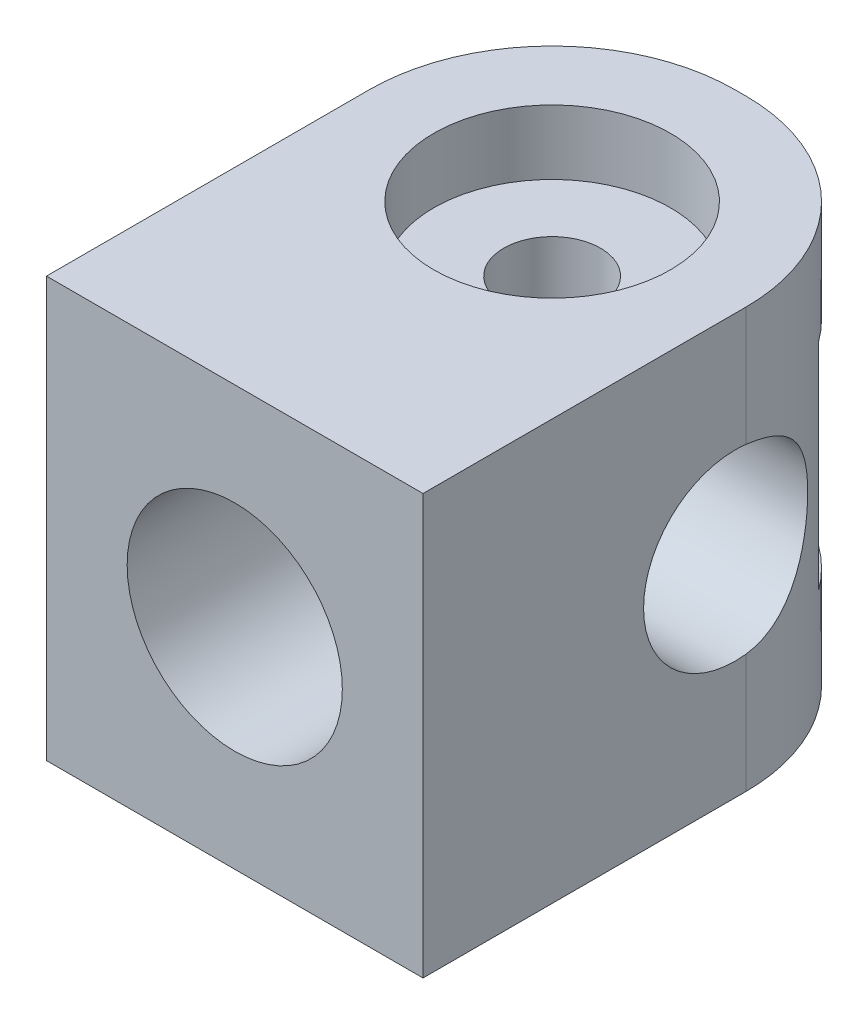
from build123d import *

# Parameters (mm, degrees)
ESQUISSE1_W             = 35
ESQUISSE1_H             = 39
BOSS_EXTRU_1_DEPTH      = 47
ESQUISSE2_R             = 10
ENL_V_MAT_EXTRU_1_DEPTH = 20
CONG_1_R                = 17
ESQUISSE3_W             = 35
ESQUISSE3_H             = 20
ENL_V_MAT_EXTRU_2_DEPTH = 7
ESQUISSE4_R             = 8.5
ENL_V_MAT_EXTRU_3_DEPTH = 29
ENL_V_MAT_EXTRU_4_DEPTH = 71.391760987
ESQUISSE7_R             = 11
ENL_V_MAT_EXTRU_5_DEPTH = 6
ENL_V_START             = -6
ESQUISSE8_R             = 11
ENL_V_MAT_EXTRU_6_DEPTH = 6
ESQUISSE10_R            = 4.5
ENL_V_MAT_EXTRU_7_DEPTH = 6


with BuildPart() as part:
    # Esquisse1 → Boss.-Extru.1 (new body)
    with BuildSketch(Plane.XY):
        with Locations((17.5, -19.5)):
            Rectangle(ESQUISSE1_W, ESQUISSE1_H)
    extrude(amount=BOSS_EXTRU_1_DEPTH)

    # Esquisse2 → Enlèv. mat.-Extru.1 (cut)
    with BuildSketch(Plane.XY.offset(47)):
        with Locations((17.5, -19.5)):
            Circle(ESQUISSE2_R)
    extrude(amount=-ENL_V_MAT_EXTRU_1_DEPTH, mode=Mode.SUBTRACT)

    # Congé1
    cong_1_edges = [part.edges().sort_by_distance(p)[0] for p in [
        (0, -19.5, 0),
        (35, -19.5, 0),
    ]]
    fillet(cong_1_edges, radius=CONG_1_R)

    # Esquisse3 → Enlèv. mat.-Extru.2 (cut)
    with BuildSketch(Plane(origin=(0, 0, 0), x_dir=(-1, 0, 0), z_dir=(0, 0, -1))):
        with Locations((-17.5, -19.5)):
            Rectangle(ESQUISSE3_W, ESQUISSE3_H)
    extrude(amount=-ENL_V_MAT_EXTRU_2_DEPTH, mode=Mode.SUBTRACT)

    # Esquisse4 → Enlèv. mat.-Extru.3 (cut)
    with BuildSketch(Plane(origin=(35, 0, 0), x_dir=(0, 0, -1), z_dir=(1, 0, 0))):
        with Locations((-18, -19.5)):
            Circle(ESQUISSE4_R)
    extrude(amount=-ENL_V_MAT_EXTRU_3_DEPTH, mode=Mode.SUBTRACT)

    # Esquisse5 → Enlèv. mat.-Extru.4 (cut, through all)
    with BuildSketch(Plane(origin=(0, 0, 0), x_dir=(1, 0, 0), z_dir=(0, 1, 0))):
        with BuildLine():
            ThreePointArc((22, -17.5), (14.318019485, -14.318019485), (17.5, -22))
            ThreePointArc((17.5, -22), (20.681980515, -20.681980515), (22, -17.5))
        make_face()
    extrude(amount=-ENL_V_MAT_EXTRU_4_DEPTH, mode=Mode.SUBTRACT)

    # Esquisse7 → Enlèv. mat.-Extru.5 (cut)
    with BuildSketch(Plane(origin=(0, 0, 0), x_dir=(1, 0, 0), z_dir=(0, 1, 0))):
        with Locations((17.5, -17.5)):
            Circle(ESQUISSE7_R)
    extrude(amount=-ENL_V_MAT_EXTRU_5_DEPTH, mode=Mode.SUBTRACT)

    # Esquisse8 → Enlèv. mat.-Extru.6 (cut)
    with BuildSketch(Plane.XZ.offset(39).offset(ENL_V_START)):
        with Locations((17.5, 17.5)):
            Circle(ESQUISSE8_R)
    extrude(amount=ENL_V_MAT_EXTRU_6_DEPTH, mode=Mode.SUBTRACT)

    # Esquisse10 → Enlèv. mat.-Extru.7 (cut)
    with BuildSketch(Plane.ZY):
        with Locations((18, -19.5)):
            Circle(ESQUISSE10_R)
    extrude(amount=-ENL_V_MAT_EXTRU_7_DEPTH, mode=Mode.SUBTRACT)


solid = part.part
